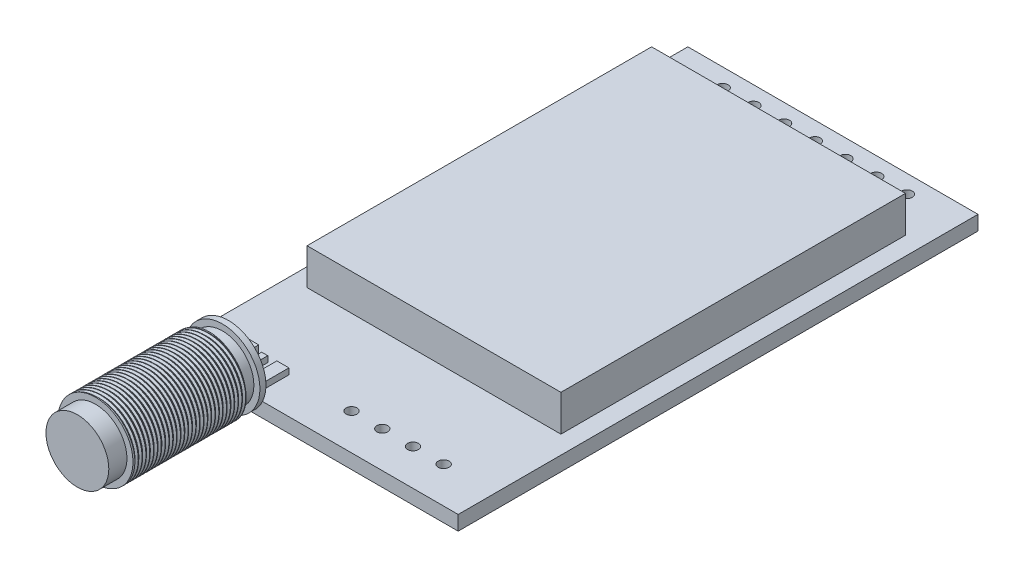
from build123d import *

# Parameters (mm, degrees)
IZIM1_W                     = 24
IZIM1_H                     = 43
Y_KSEKLIK_EKSTR_ZYON1_DEPTH = 1.2
IZIM2_W                     = 21
IZIM2_H                     = 28.5
Y_KSEKLIK_EKSTR_ZYON2_DEPTH = 3
IZIM3_R                     = 0.45
KES_EKSTR_ZYON1_DEPTH       = 3
IZIM4_R                     = 3.1
Y_KSEKLIK_EKSTR_ZYON3_DEPTH = 0.5
IZIM5_R                     = 2.6
Y_KSEKLIK_EKSTR_ZYON4_DEPTH = 1
IZIM6_R                     = 3.1
Y_KSEKLIK_EKSTR_ZYON5_DEPTH = 11
KES_EKSTR_ZYON2_START       = -1.5
IZIM7_R                     = 3.1
IZIM7_R_2                   = 2.6
KES_EKSTR_ZYON2_DEPTH       = 1.5
DI_1_PITCH                  = 0.3175
Y_KSEKLIK_EKSTR_ZYON6_START = -6
Y_KSEKLIK_EKSTR_ZYON6_DEPTH = 1
L_O_ALTMA1_COUNT            = 2
L_O_ALTMA1_PITCH            = 3
Y_KSEKLIK_EKSTR_ZYON7_START = -4.75
Y_KSEKLIK_EKSTR_ZYON7_DEPTH = 0.5


with BuildPart() as part:
    # Çizim1 → Yükseklik-Ekstrüzyon1 (new body)
    with BuildSketch(Plane(origin=(0, 0, 0), x_dir=(1, 0, 0), z_dir=(0, 1, 0))):
        Rectangle(IZIM1_W, IZIM1_H)
    extrude(amount=Y_KSEKLIK_EKSTR_ZYON1_DEPTH)

    # Çizim2 → Yükseklik-Ekstrüzyon2 (add)
    with BuildSketch(Plane(origin=(0, 1.2, 0), x_dir=(1, 0, 0), z_dir=(0, 1, 0))):
        with Locations((0, 2.75)):
            Rectangle(IZIM2_W, IZIM2_H)
    extrude(amount=Y_KSEKLIK_EKSTR_ZYON2_DEPTH)

    # Çizim3 → Kes-Ekstrüzyon1 (cut)
    with BuildSketch(Plane(origin=(0, 1.2, 0), x_dir=(1, 0, 0), z_dir=(0, 1, 0))):
        with Locations(Location((-7.62, 20, 0), (0, 0, 270))):
            Circle(IZIM3_R)
        with Locations(Location((-5.08, 20, 0), (0, 0, 270))):
            Circle(IZIM3_R)
        with Locations(Location((-2.54, 20, 0), (0, 0, 270))):
            Circle(IZIM3_R)
        with Locations(Location((0, 20, 0), (0, 0, 270))):
            Circle(IZIM3_R)
        with Locations(Location((2.54, 20, 0), (0, 0, 270))):
            Circle(IZIM3_R)
        with Locations(Location((5.08, 20, 0), (0, 0, 270))):
            Circle(IZIM3_R)
        with Locations(Location((7.62, 20, 0), (0, 0, 270))):
            Circle(IZIM3_R)
        with Locations(Location((7.8, -18.5, 0), (0, 0, 270))):
            Circle(IZIM3_R)
        with Locations(Location((5.26, -18.5, 0), (0, 0, 270))):
            Circle(IZIM3_R)
        with Locations(Location((2.72, -18.5, 0), (0, 0, 270))):
            Circle(IZIM3_R)
        with Locations(Location((0.18, -18.5, 0), (0, 0, 270))):
            Circle(IZIM3_R)
    extrude(amount=-KES_EKSTR_ZYON1_DEPTH, mode=Mode.SUBTRACT)

    # Çizim4 → Yükseklik-Ekstrüzyon3 (add)
    with BuildSketch(Plane.XY.offset(21.5)):
        with Locations(Location((-7, 2.5, 0), (0, 0, 204.793862463))):
            Circle(IZIM4_R)
    extrude(amount=Y_KSEKLIK_EKSTR_ZYON3_DEPTH)

    # Çizim5 → Yükseklik-Ekstrüzyon4 (add)
    with BuildSketch(Plane.XY.offset(22)):
        with Locations((-7, 2.5)):
            Circle(IZIM5_R)
    extrude(amount=Y_KSEKLIK_EKSTR_ZYON4_DEPTH)

    # Çizim6 → Yükseklik-Ekstrüzyon5 (add)
    with BuildSketch(Plane.XY.offset(23)):
        with Locations(Location((-7, 2.5, 0), (0, 0, 204.793862463))):
            Circle(IZIM6_R)
    extrude(amount=Y_KSEKLIK_EKSTR_ZYON5_DEPTH)

    # Çizim7 → Kes-Ekstrüzyon2 (cut)
    with BuildSketch(Plane.XY.offset(34).offset(KES_EKSTR_ZYON2_START)):
        with Locations((-7, 2.5)):
            Circle(IZIM7_R)
        with Locations((-7, 2.5)):
            Circle(IZIM7_R_2, mode=Mode.SUBTRACT)
    extrude(amount=KES_EKSTR_ZYON2_DEPTH, mode=Mode.SUBTRACT)

    # Diş1: arcs per turn and ends read off the stored shape
    # Diş1: the profile of Diş Profili1 profile screwed along a right-hand helix through 31.496063 turns, 6 arcs to a turn; built about Z, then put on its axis
    di_1_z = Axis((0, 0, 0), (0, 0, 1))
    di_1_corners = [(3.1003, 0, -0.000173205), (3.1003, 0, 0.277985704), (2.928148085, 0, 0.17859375), (2.928148085, 0, 0.09921875)]
    with BuildLine(mode=Mode.PRIVATE) as di_1_profile:
        Line(di_1_corners[0], di_1_corners[1])
        Line(di_1_corners[1], di_1_corners[2])
        Line(di_1_corners[2], di_1_corners[3])
        Line(di_1_corners[3], di_1_corners[0])
    di_1_cap = Face(di_1_profile.wire())
    di_1_turn_angles = [0, 30, 60, 90, 120, 150, 180, 210, 240, 270, 300, 330, 360]
    di_1_turn_weights = [1, 0.8660254037844387, 1, 0.8660254037844387, 1, 0.8660254037844387, 1, 0.8660254037844387, 1, 0.8660254037844387, 1, 0.8660254037844387, 1]
    di_1_turn_rails = [Edge.make_bspline([Vector(p[0], p[1], 0).rotate(di_1_z, di_1_turn_angles[k]) / di_1_turn_weights[k] + Vector(0, 0, p[2] + DI_1_PITCH * di_1_turn_angles[k] / 360) for k in range(13)], [0, 0, 0, 1, 1, 2, 2, 3, 3, 4, 4, 5, 5, 6, 6, 6], 2, di_1_turn_weights) for p in di_1_corners]
    di_1_turn_sides = [Face.make_surface_from_curves(di_1_turn_rails[p[0]], di_1_turn_rails[p[1]]) for p in [(0, 1), (1, 2), (2, 3), (3, 0)]]
    di_1_last_angles = [11160, 11190, 11220, 11250, 11280, 11309.291338583, 11338.582677165]
    di_1_last_weights = [1, 0.8660254037844387, 1, 0.8660254037844387, 1, 0.872143242535045, 1]
    di_1_last_rails = [Edge.make_bspline([Vector(p[0], p[1], 0).rotate(di_1_z, di_1_last_angles[k]) / di_1_last_weights[k] + Vector(0, 0, p[2] + DI_1_PITCH * di_1_last_angles[k] / 360) for k in range(7)], [0, 0, 0, 1, 1, 2, 2, 3, 3, 3], 2, di_1_last_weights) for p in di_1_corners]
    di_1_last_sides = [Face.make_surface_from_curves(di_1_last_rails[p[0]], di_1_last_rails[p[1]]) for p in [(0, 1), (1, 2), (2, 3), (3, 0)]]
    di_1 = Plane(origin=(-7, 2.5, 32.5), x_dir=(-1, 0, 0), z_dir=(0, 0, -1)) * Solid(Shell([*[p.moved(Location((0, 0, DI_1_PITCH * i))) for i in range(31) for p in di_1_turn_sides], *di_1_last_sides, di_1_cap, di_1_cap.rotate(di_1_z, 11338.582677165).moved(Location((0, 0, DI_1_PITCH * 11338.582677165 / 360)))]))
    add(di_1, mode=Mode.SUBTRACT)

    # Çizim12 → Yükseklik-Ekstrüzyon6 (add)
    with BuildSketch(Plane.ZY.offset(12).offset(Y_KSEKLIK_EKSTR_ZYON6_START)):
        Polygon((21.5, 4.6), (21.5, 1.2), (18.5, 1.2), (18.5, 1.7), (21, 1.7), (21, 4.6), align=None)
    y_kseklik_ekstr_zyon6 = extrude(amount=-Y_KSEKLIK_EKSTR_ZYON6_DEPTH)

    # LÇoğaltma1: Yükseklik-Ekstrüzyon6 ×2
    with Locations(*[(-i * L_O_ALTMA1_PITCH, 0, 0) for i in range(1, L_O_ALTMA1_COUNT)]):
        add(y_kseklik_ekstr_zyon6)

    # Çizim13 → Yükseklik-Ekstrüzyon7 (add)
    with BuildSketch(Plane.ZY.offset(12).offset(Y_KSEKLIK_EKSTR_ZYON7_START)):
        Polygon((21.5, 4.6), (21, 4.6), (21, 1.7), (18.5, 1.7), (18.5, 1.2), (21.5, 1.2), align=None)
    extrude(amount=-Y_KSEKLIK_EKSTR_ZYON7_DEPTH)


solid = part.part
